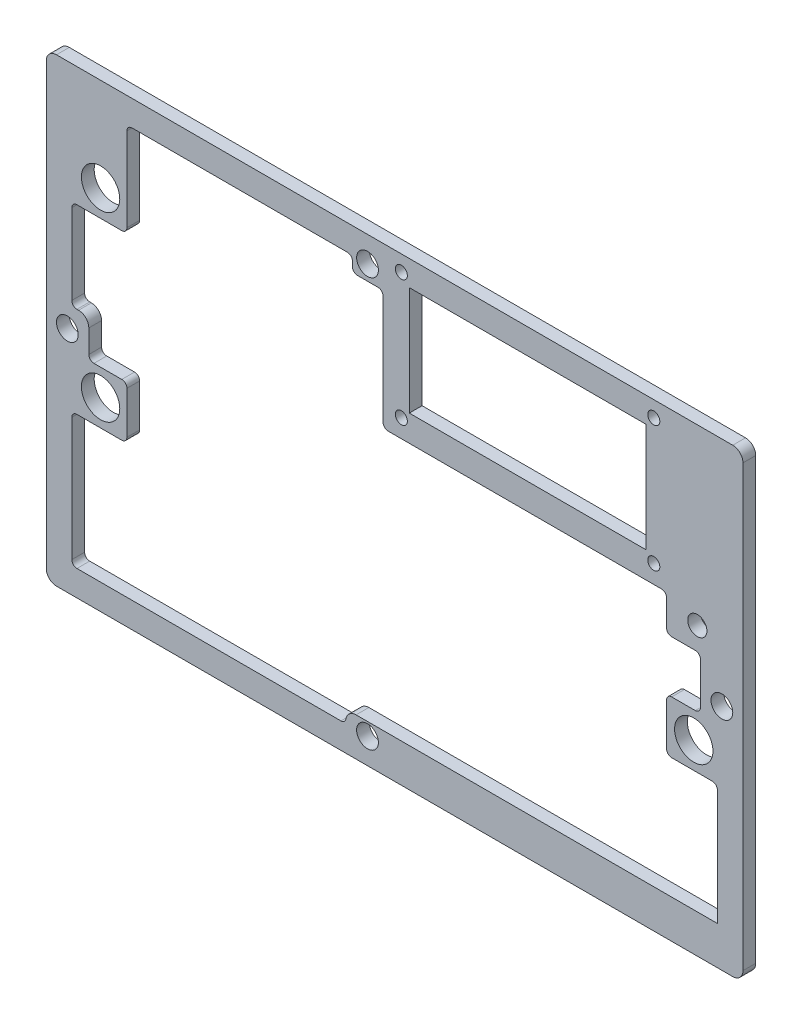
from build123d import *

# Parameters (mm, degrees)
SKETCH1_W                  = 173.0375
SKETCH1_H                  = 114.3
BOSS_EXTRUDE1_DEPTH        = 3.175
SKETCH3_R                  = 2.38125
SKETCH3_R_2                = 4.7625
CUT_EXTRUDE1_DEPTH         = 149.360729792
F_6_CLEARANCE_HOLE1_D      = 4.3053
F_2_CLEARANCE_HOLE1_D      = 2.7051
SKETCH8_W                  = 58.74
SKETCH8_H                  = 26.99
CUT_EXTRUDE2_DEPTH         = 149.360729792
F_3_0_213_DIAMETER_HOLE1_D = 5.4102
F_3_0_3_DIAMETER_HOLE1_D   = 3
FILLET1_R                  = 1.27
FILLET2_R                  = 2.54


with BuildPart() as part:
    # Sketch1 → Boss-Extrude1 (new body)
    with BuildSketch(Plane.XY):
        with Locations((25.118, -40.513)):
            Rectangle(SKETCH1_W, SKETCH1_H)
    extrude(amount=BOSS_EXTRUDE1_DEPTH)

    # Sketch3 → Cut-Extrude1 (cut, through all)
    with BuildSketch(Plane.XY.offset(3.175)):
        with Locations((100.302, -26.543)):
            Circle(SKETCH3_R)
        with Locations((99.413, -51.6255)):
            Circle(SKETCH3_R_2)
        with Locations((-47.907, -51.6255)):
            Circle(SKETCH3_R_2)
        with Locations((-47.907, -6.5405)):
            Circle(SKETCH3_R_2)
    extrude(amount=-CUT_EXTRUDE1_DEPTH, mode=Mode.SUBTRACT)

    # #6 Clearance Hole1 (through all)
    with Locations(Plane.XY.offset(3.175)):
        with Locations((18.387, 10.287), (-56.162, -40.894), (106.398, -40.894), (18.387, -91.313)):
            Hole(F_6_CLEARANCE_HOLE1_D / 2)

    # #2 Clearance Hole1 (through all)
    with Locations(Plane.XY.offset(3.175)):
        with Locations((26.788, 12.7), (89.488, 12.7), (89.488, -18.6), (26.788, -18.6)):
            Hole(F_2_CLEARANCE_HOLE1_D / 2)

    # Sketch8 → Cut-Extrude2 (cut, through all)
    with BuildSketch(Plane.XY.offset(3.175)):
        Polygon((92.658, -32.150898303), (92.658, -23.12755), (22.26045, -23.12755), (22.26045, 6.54685), (14.64685, 6.54685), (14.64685, 10.287), (-41.367, 10.287), (-41.367, -13.0805), (-55.05075, -13.0805), (-55.05075, -35.56635), (-50.83435, -35.56635), (-50.83435, -45.0855), (-41.367, -45.0855), (-41.367, -58.1655), (-55.05075, -58.1655), (-55.05075, -91.313), (13.05935, -91.313), (13.05935, -88.138), (105.28675, -88.138), (105.28675, -58.1655), (92.658, -58.1655), (92.658, -45.0855), (101.07035, -45.0855), (101.07035, -32.150898303), align=None)
        with Locations((58.138, -3.125)):
            Rectangle(SKETCH8_W, SKETCH8_H)
    extrude(amount=-CUT_EXTRUDE2_DEPTH, mode=Mode.SUBTRACT)

    # #3 (0.213) Diameter Hole1 (through all)
    with Locations(Plane(origin=(18.387, 10.287, 3.175), x_dir=(1, 0, 0), z_dir=(0, 0, 1))):
        with Locations((0, 0), (-74.549, -51.181), (0, -101.6), (88.011, -51.181)):
            Hole(F_3_0_213_DIAMETER_HOLE1_D / 2)

    # Ø3.0 (3) Diameter Hole1 (through all)
    with Locations(Plane.XY.offset(3.175)):
        with Locations((26.788, 12.7), (89.488, 12.7), (89.488, -18.6), (26.788, -18.6)):
            Hole(F_3_0_3_DIAMETER_HOLE1_D / 2)

    # Fillet1
    fillet1_edges = [part.edges().sort_by_distance(p)[0] for p in [
        (-41.367, 10.287, 1.5875),
        (-41.367, -13.0805, 1.5875),
        (-55.05075, -13.0805, 1.5875),
        (-55.05075, -35.56635, 1.5875),
        (-50.83435, -45.0855, 1.5875),
        (-41.367, -45.0855, 1.5875),
        (-41.367, -58.1655, 1.5875),
        (-55.05075, -58.1655, 1.5875),
        (-55.05075, -91.313, 1.5875),
        (13.05935, -91.313, 1.5875),
        (105.28675, -58.1655, 1.5875),
        (92.658, -58.1655, 1.5875),
        (92.658, -45.0855, 1.5875),
        (101.07035, -45.0855, 1.5875),
        (101.07035, -32.150898303, 1.5875),
        (92.658, -32.150898303, 1.5875),
        (92.658, -23.12755, 1.5875),
        (22.26045, -23.12755, 1.5875),
        (14.64685, 6.54685, 1.5875),
        (22.26045, 6.54685, 1.5875),
        (14.64685, 10.287, 1.5875),
    ]]
    fillet(fillet1_edges, radius=FILLET1_R)

    # Fillet2
    fillet2_edges = [part.edges().sort_by_distance(p)[0] for p in [
        (13.05935, -88.138, 1.5875),
        (-50.83435, -35.56635, 1.5875),
        (111.63675, 16.637, 1.5875),
        (111.63675, -97.663, 1.5875),
        (-61.40075, -97.663, 1.5875),
        (-61.40075, 16.637, 1.5875),
    ]]
    fillet(fillet2_edges, radius=FILLET2_R)


solid = part.part
